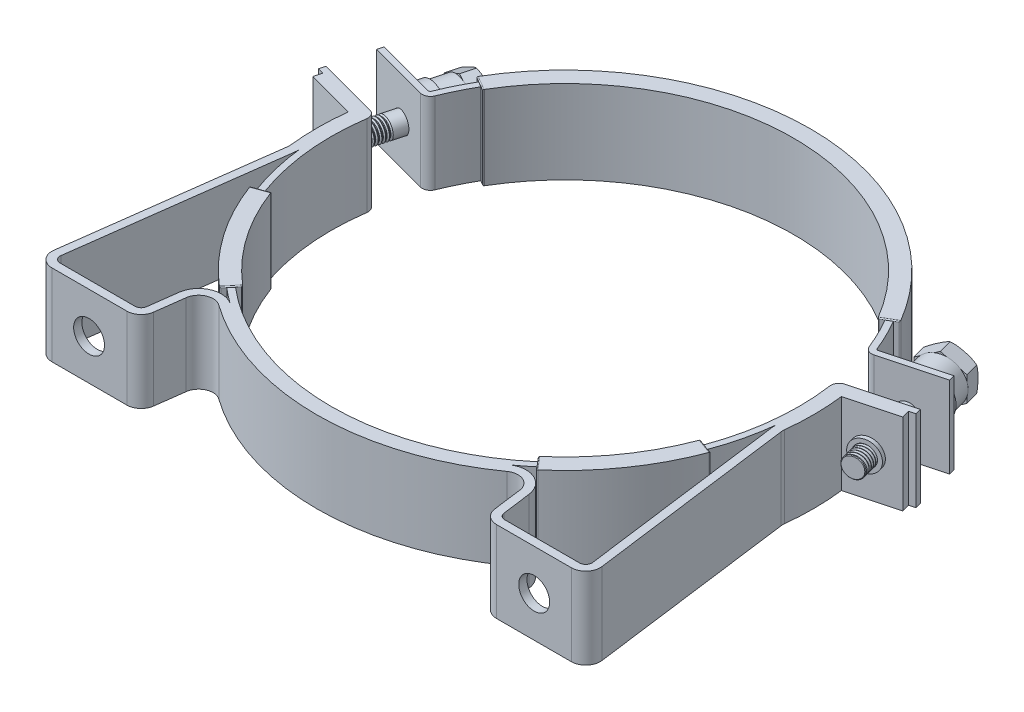
from build123d import *

# Parameters (mm, degrees)
AUFSATZ_LINEAR_AUSTRAGEN1_DEPTH      = 39.5
AUFSATZ_LINEAR_AUSTRAGEN1_2_DEPTH    = 39.5
AUFSATZ_LINEAR_AUSTRAGEN2_DEPTH      = 20.25
AUFSATZ_LINEAR_AUSTRAGEN2_DEPTH_BACK = 20.25
VERRUNDUNG1_START                    = -142
VERRUNDUNG1_DEPTH                    = 8.952459693
VERRUNDUNG1_START_2                  = -0.5
VERRUNDUNG1_2_DEPTH                  = 40.5
VERRUNDUNG2_R                        = 0.5
VERRUNDUNG3_R                        = 0.5
VERRUNDUNG4_R                        = 0.5
VERRUNDUNG5_R                        = 0.5
VERRUNDUNG6_R                        = 0.5
SCHNITT_LINEAR_AUSTRAGEN1_REACH      = 211.137
SKIZZE6_R                            = 5.1
SCHNITT_LINEAR_AUSTRAGEN2_REACH      = 286.937
SKIZZE7_R                            = 7.5
AUFSATZ_LINEAR_START                 = 2
SKIZZE8_R                            = 7.1
SKIZZE8_R_2                          = 5.1
AUFSATZ_LINEAR_AUSTRAGEN3_DEPTH      = 2
SKIZZE9_R                            = 7.1
SKIZZE9_R_2                          = 5.1
AUFSATZ_LINEAR_AUSTRAGEN4_DEPTH      = 2
SKIZZE10_R                           = 5.1
SCHNITT_LINEAR_AUSTRAGEN3_DEPTH      = 209.762581045
SKIZZE11_R                           = 12
SKIZZE11_R_2                         = 5.1
AUFSATZ_LINEAR_AUSTRAGEN5_DEPTH      = 10
SKIZZE12_R                           = 11
SKIZZE12_R_2                         = 5.1
AUFSATZ_LINEAR_AUSTRAGEN6_DEPTH      = 10
AUFSATZ_LINEAR_AUSTRAGEN7_DEPTH      = 8
SKIZZE17_R                           = 5
AUFSATZ_LINEAR_AUSTRAGEN8_DEPTH      = 40
FASE1_SIZE                           = 0.3
SKIZZE18_R                           = 5
AUFSATZ_LINEAR_AUSTRAGEN9_DEPTH      = 40
FASE2_SIZE                           = 0.3
GEWINDE1_PITCH                       = 1.5
GEWINDE2_PITCH                       = 1.5


with BuildPart() as part:
    # Skizze1 → Aufsatz-Linear austragen1 (new body)
    with BuildSketch(Plane(origin=(0, 0, 0), x_dir=(1, 0, 0), z_dir=(0, 1, 0))):
        with BuildLine():
            Line((144.2235429, 72.395909932), (115.275972117, 64.639431727))
            ThreePointArc((115.275972117, 64.639431727), (112.972683108, 62.978903965), (112.351716442, 60.208183281))
            ThreePointArc((112.351716442, 60.208183281), (4.8e-08, -69.395910091), (-112.351716346, 60.208183281))
            ThreePointArc((-112.351716346, 60.208183281), (-112.972683012, 62.978903965), (-115.275972021, 64.639431727))
            Line((-115.275972021, 64.639431727), (-144.223542785, 72.395909927))
            Line((-144.223542785, 72.395909927), (-144.999999917, 69.49813246))
            Line((-144.999999917, 69.49813246), (-142.102222502, 68.721675341))
            Line((-142.102222502, 68.721675341), (-143.137498683, 64.857972036))
            Line((-143.137498683, 64.857972036), (-119.629854786, 58.559117832))
            ThreePointArc((-119.629854786, 58.559117832), (-120.498608358, 44.683203119), (-119.763266415, 30.799579165))
            ThreePointArc((-119.763266415, 30.799579165), (-119.720827887, 29.955782858), (-119.780354587, 29.11301966))
            Line((-119.780354587, 29.11301966), (-132.958143829, -70.982226753))
            ThreePointArc((-132.958143829, -70.982226753), (-131.28090846, -76.511330778), (-126.018029832, -78.895910061))
            Line((-126.018029832, -78.895910061), (-89.707387273, -78.895910061))
            ThreePointArc((-89.707387273, -78.895910061), (-85.091966551, -77.158788715), (-82.767273229, -72.809593391))
            Line((-82.767273229, -72.809593391), (-80.925582719, -58.820564741))
            ThreePointArc((-80.925582719, -58.820564741), (-76.778386451, -53.315555775), (-69.923521345, -54.033319652))
            ThreePointArc((-69.923521345, -54.033319652), (-5.5e-08, -76.395910029), (69.92352124, -54.03331967))
            ThreePointArc((69.92352124, -54.03331967), (76.778386357, -53.315555769), (80.92558264, -58.820564741))
            Line((80.92558264, -58.820564741), (82.76727315, -72.809593391))
            ThreePointArc((82.76727315, -72.809593391), (85.091966472, -77.158788715), (89.707387194, -78.895910061))
            Line((89.707387194, -78.895910061), (126.018029752, -78.895910061))
            ThreePointArc((126.018029752, -78.895910061), (131.280908381, -76.511330777), (132.958143749, -70.982226749))
            Line((132.958143749, -70.982226749), (119.780354507, 29.11301966))
            ThreePointArc((119.780354507, 29.11301966), (119.720827807, 29.955782857), (119.763266335, 30.799579163))
            ThreePointArc((119.763266335, 30.799579163), (120.498608279, 44.683203118), (119.629854707, 58.559117831))
            Line((119.629854707, 58.559117831), (143.137498571, 64.857972025))
            Line((143.137498571, 64.857972025), (142.102222389, 68.721675334))
            Line((142.102222389, 68.721675334), (144.999999989, 69.498132628))
            Line((144.999999989, 69.498132628), (144.2235429, 72.395909932))
        make_face()
        with BuildLine():
            Line((115.814575058, 28.5909149), (128.992364281, -71.504331512))
            ThreePointArc((128.992364281, -71.504331512), (128.273549117, -73.873947541), (126.018029687, -74.895910099))
            Line((126.018029687, -74.895910099), (89.707387107, -74.895910099))
            ThreePointArc((89.707387107, -74.895910099), (87.729349611, -74.151429496), (86.73305246, -72.287488592))
            Line((86.73305246, -72.287488592), (84.891362054, -58.298459981))
            ThreePointArc((84.891362054, -58.298459981), (78.374339367, -49.647731616), (67.602408509, -50.775646305))
            ThreePointArc((67.602408509, -50.775646305), (100.447382842, -14.909241346), (115.787722318, 31.241222664))
            ThreePointArc((115.787722318, 31.241222664), (115.721033153, 29.915257057), (115.814575058, 28.5909149))
        make_face(mode=Mode.SUBTRACT)
        with BuildLine():
            Line((-84.8913622, -58.298459946), (-86.733052605, -72.287488545))
            ThreePointArc((-86.733052605, -72.287488545), (-87.729349763, -74.151429427), (-89.707387248, -74.89591002))
            Line((-89.707387248, -74.89591002), (-126.018029829, -74.89591002))
            ThreePointArc((-126.018029829, -74.89591002), (-128.273549258, -73.873947461), (-128.992364422, -71.504331432))
            Line((-128.992364422, -71.504331432), (-115.814575199, 28.59091498))
            ThreePointArc((-115.814575199, 28.59091498), (-115.721033243, 29.915257139), (-115.787722358, 31.241222754))
            ThreePointArc((-115.787722358, 31.241222754), (-100.447382929, -14.909241248), (-67.60240865, -50.775646226))
            ThreePointArc((-67.60240865, -50.775646226), (-78.374339529, -49.647731545), (-84.8913622, -58.298459946))
        make_face(mode=Mode.SUBTRACT)
    extrude(amount=AUFSATZ_LINEAR_AUSTRAGEN1_DEPTH)



with BuildPart() as body_2:
    # Skizze1 → Aufsatz-Linear austragen1 2 (new body)
    with BuildSketch(Plane(origin=(0, 0, 0), x_dir=(1, 0, 0), z_dir=(0, 1, 0))):
        with BuildLine():
            Line((110.099591321, 83.957948398), (139.047161711, 91.714426507))
            Line((139.047161711, 91.714426507), (138.270704595, 94.612203912))
            Line((138.270704595, 94.612203912), (109.323133796, 86.855725696))
            ThreePointArc((109.323133796, 86.855725696), (108.616891131, 86.927329376), (108.136107822, 87.449587165))
            ThreePointArc((108.136107822, 87.449587165), (-2.29e-07, 160.604089878), (-108.136108295, 87.449587187))
            ThreePointArc((-108.136108295, 87.449587187), (-108.616891604, 86.927329398), (-109.323134269, 86.855725719))
            Line((-109.323134269, 86.855725719), (-138.270705059, 94.612203933))
            Line((-138.270705059, 94.612203933), (-139.047162195, 91.714426455))
            Line((-139.047162195, 91.714426455), (-110.099591405, 83.957948238))
            ThreePointArc((-110.099591405, 83.957948238), (-107.274620727, 84.244362961), (-105.351487478, 86.333394131))
            ThreePointArc((-105.351487478, 86.333394131), (-9.3e-08, 157.604090165), (105.351487396, 86.333394285))
            ThreePointArc((105.351487396, 86.333394285), (107.274620646, 84.244363119), (110.099591321, 83.957948398))
        make_face()
    extrude(amount=AUFSATZ_LINEAR_AUSTRAGEN1_2_DEPTH)


with BuildPart() as part_1:
    add(part.part)

    add(body_2.part)  # Aufsatz-Linear austragen2 merges body 2
    # Skizze5 → Aufsatz-Linear austragen2 (add, two sides: drawn at the far end of the back side and taken through both)
    with BuildSketch(Plane(origin=(0, 19.75, 0), x_dir=(1, 0, 0), z_dir=(0, 1, 0)).offset(-AUFSATZ_LINEAR_AUSTRAGEN2_DEPTH_BACK)):
        with BuildLine():
            Line((-104.133812627, 5.670392928), (-111.651424736, 2.934205889))
            ThreePointArc((-111.651424736, 2.934205889), (-97.479093281, -24.151505937), (-76.874072584, -46.733000266))
            Line((-76.874072584, -46.733000266), (-71.731723043, -40.604586726))
            ThreePointArc((-71.731723043, -40.604586726), (-90.925876926, -19.562894447), (-104.133812627, 5.670392928))
        make_face()
        with BuildLine():
            Line((71.731723023, -40.604586726), (76.874072564, -46.733000266))
            ThreePointArc((76.874072564, -46.733000266), (97.479093261, -24.151505937), (111.651424716, 2.934205889))
            Line((111.651424716, 2.934205889), (104.133812607, 5.670392928))
            ThreePointArc((104.133812607, 5.670392928), (90.925876906, -19.562894447), (71.731723023, -40.604586726))
        make_face()
        with BuildLine():
            Line((95.877844551, 100.036539624), (102.806113346, 104.036577478))
            ThreePointArc((102.806113346, 104.036577478), (-1e-08, 163.104089988), (-102.806113366, 104.036577478))
            Line((-102.806113366, 104.036577478), (-95.877844571, 100.036539624))
            ThreePointArc((-95.877844571, 100.036539624), (-1e-08, 155.104089988), (95.877844551, 100.036539624))
        make_face()
    extrude(amount=AUFSATZ_LINEAR_AUSTRAGEN2_DEPTH + AUFSATZ_LINEAR_AUSTRAGEN2_DEPTH_BACK)

    # Verrundung1: read off the stored shape, not the designer's step
    # Verrundung1 outline → Verrundung1 (cut)
    with BuildSketch(Plane(origin=(0, 0, 0), x_dir=(0.49999999999999767, 0, -0.86602540378444), z_dir=(0.8660254037844399, 0, 0.49999999999999795)).offset(VERRUNDUNG1_START)):
        with BuildLine():
            ThreePointArc((39.195262336, -0.5), (38.841708945, -0.353553391), (38.695262336, 0))
            Line((38.695262336, 0), (38.695262336, -0.5))
            Line((38.695262336, -0.5), (39.195262336, -0.5))
        make_face()
        with BuildLine():
            ThreePointArc((38.695262336, 39.5), (38.841708945, 39.853553391), (39.195262336, 40))
            Line((39.195262336, 40), (38.695262336, 40))
            Line((38.695262336, 40), (38.695262336, 39.5))
        make_face()
    extrude(amount=VERRUNDUNG1_DEPTH, mode=Mode.SUBTRACT)

    # Verrundung1 2 outline → Verrundung1 2 (cut)
    with BuildSketch(Plane(origin=(0, 0, 0), x_dir=(1, 0, 0), z_dir=(0, 1, 0)).offset(VERRUNDUNG1_START_2)):
        with BuildLine():
            ThreePointArc((-102.370356178, 103.784992948), (-102.603860828, 104.090635116), (-102.551243757, 104.471650864))
            ThreePointArc((-102.551243757, 104.471650864), (-102.678908999, 104.254249163), (-102.806113366, 104.036577478))
            Line((-102.806113366, 104.036577478), (-102.370356178, 103.784992948))
        make_face()
        with BuildLine():
            ThreePointArc((-95.627195798, 100.463999727), (-95.930706485, 100.23433482), (-96.307948932, 100.284860492))
            Line((-96.307948932, 100.284860492), (-95.877844571, 100.036539624))
            ThreePointArc((-95.877844571, 100.036539624), (-95.752758718, 100.250409544), (-95.627195798, 100.463999727))
        make_face()
    extrude(amount=VERRUNDUNG1_2_DEPTH, mode=Mode.SUBTRACT)

    # Verrundung2
    # the kernel refuses this fillet: 0.5 mm, written as the material it takes off along each edge
    with BuildSketch(Plane(origin=(95.877844551, 41.241604342, -100.036539624), x_dir=(-0.5058226987035669, 0, -0.8626374658431203), z_dir=(0, -1, 0))) as verrundung2_piece_1:
        with BuildLine():
            CenterArc((0.496642991, 0.499998754), VERRUNDUNG2_R, 180.385980176, 89.486129618)
            Line((-0.003345664, 0.496630467), (0, 0))
            ThreePointArc((0, 0), (0.24776347, 0.000276517), (0.495526939, 0))
        make_face()
    extrude(amount=42.983208684, mode=Mode.SUBTRACT)
    with BuildSketch(Plane(origin=(102.806113346, 41.260573701, -104.036577478), x_dir=(-0.5054635224785541, 0, -0.8628479746998148), z_dir=(0, -1, 0))) as verrundung2_piece_2:
        with BuildLine():
            CenterArc((0.503170175, -0.499998878), VERRUNDUNG2_R, 89.878612425, 90.483514427)
            Line((0.003180161, -0.50315901), (0, 0))
            ThreePointArc((0, 0), (0.25211474, 0.000267067), (0.50422948, 0))
        make_face()
    extrude(amount=43.021147401, mode=Mode.SUBTRACT)
    with BuildSketch(Plane(origin=(94.795312797, -0.5, -99.411539624), x_dir=(-0.49999999999999944, 0, -0.866025403784439), z_dir=(0.866025403784439, 0, -0.49999999999999944))) as verrundung2_piece_3:
        with BuildLine():
            CenterArc((VERRUNDUNG2_R, VERRUNDUNG2_R), VERRUNDUNG2_R, 180, 90)
            Line((0, VERRUNDUNG2_R), (0, 0))
            Line((0, 0), (VERRUNDUNG2_R, 0))
        make_face()
    extrude(amount=10.500075707, mode=Mode.SUBTRACT)
    with BuildSketch(Plane(origin=(94.795312797, 40, -99.411539624), x_dir=(-0.49999999999999944, 0, -0.866025403784439), z_dir=(0.866025403784439, 0, -0.49999999999999944))) as verrundung2_piece_4:
        with BuildLine():
            CenterArc((VERRUNDUNG2_R, -VERRUNDUNG2_R), VERRUNDUNG2_R, 90, 90)
            Line((0, -VERRUNDUNG2_R), (0, 0))
            Line((0, 0), (VERRUNDUNG2_R, 0))
        make_face()
    extrude(amount=10.500075707, mode=Mode.SUBTRACT)

    # Verrundung3
    verrundung3_edges = [part_1.edges().sort_by_distance(p)[0] for p in [
        (-111.651424736, 19.75, -2.934205889),
        (-107.892618682, -0.5, -4.302299408),
        (-104.133812627, 19.75, -5.670392928),
        (-107.892618682, 40, -4.302299408),
    ]]
    fillet(verrundung3_edges, radius=VERRUNDUNG3_R - 0.0001)  # a hair under: the kernel refuses the full size

    # Verrundung4
    verrundung4_edges = [part_1.edges().sort_by_distance(p)[0] for p in [
        (-71.731723043, 19.75, 40.604586726),
        (-74.302897814, -0.5, 43.668793496),
        (-76.874072584, 19.75, 46.733000266),
        (-74.302897814, 40, 43.668793496),
    ]]
    fillet(verrundung4_edges, radius=VERRUNDUNG4_R - 0.0001)  # a hair under: the kernel refuses the full size

    # Verrundung5
    verrundung5_edges = [part_1.edges().sort_by_distance(p)[0] for p in [
        (76.874072564, 19.75, 46.733000266),
        (74.302897794, -0.5, 43.668793496),
        (71.731723023, 19.75, 40.604586726),
        (74.302897794, 40, 43.668793496),
    ]]
    fillet(verrundung5_edges, radius=VERRUNDUNG5_R - 0.0001)  # a hair under: the kernel refuses the full size

    # Verrundung6
    verrundung6_edges = [part_1.edges().sort_by_distance(p)[0] for p in [
        (104.133812607, 19.75, -5.670392928),
        (107.892618662, -0.5, -4.302299408),
        (111.651424716, 19.75, -2.934205889),
        (107.892618662, 40, -4.302299408),
    ]]
    fillet(verrundung6_edges, radius=VERRUNDUNG6_R - 0.0001)  # a hair under: the kernel refuses the full size

    # Skizze6 → Schnitt-Linear austragen1 (cut, up to next)
    with BuildSketch(Plane(origin=(-6.626098717, 0, -24.728937051), x_dir=(0.9659258262495816, 0, -0.25881904524988736), z_dir=(0.25881904524988736, 0, 0.9659258262495816)), mode=Mode.PRIVATE) as schnitt_linear_austragen1_sk1:
        with Locations((141.046685129, 19.400568229)):
            Circle(SKIZZE6_R)
    schnitt_linear_austragen1_tool1 = extrude(schnitt_linear_austragen1_sk1.sketch, amount=-SCHNITT_LINEAR_AUSTRAGEN1_REACH, mode=Mode.PRIVATE) & part_1.part
    schnitt_linear_austragen1 = schnitt_linear_austragen1_tool1.solids().sort_by_distance((129.614537, 19.400568, -61.234505))[0]
    add(schnitt_linear_austragen1, mode=Mode.SUBTRACT)

    # Spiegeln1: Schnitt-Linear austragen1 across plane
    add(schnitt_linear_austragen1.mirror(Plane(origin=(0, 0, 0), x_dir=(0, 0, 1), z_dir=(1, 0, 0))), mode=Mode.SUBTRACT)

    # Skizze7 → Schnitt-Linear austragen2 (cut, up to next)
    with BuildSketch(Plane.XY.offset(78.895910061), mode=Mode.PRIVATE) as schnitt_linear_austragen2_sk1:
        with Locations((108, 19.75)):
            Circle(SKIZZE7_R)
    schnitt_linear_austragen2_tool1 = extrude(schnitt_linear_austragen2_sk1.sketch, amount=-SCHNITT_LINEAR_AUSTRAGEN2_REACH, mode=Mode.PRIVATE) & part_1.part
    # Skizze7 → Schnitt-Linear austragen2 (cut, up to next)
    with BuildSketch(Plane.XY.offset(78.895910061), mode=Mode.PRIVATE) as schnitt_linear_austragen2_sk2:
        with Locations((-108, 19.75)):
            Circle(SKIZZE7_R)
    schnitt_linear_austragen2_tool2 = extrude(schnitt_linear_austragen2_sk2.sketch, amount=-SCHNITT_LINEAR_AUSTRAGEN2_REACH, mode=Mode.PRIVATE) & part_1.part
    add(schnitt_linear_austragen2_tool1.solids().sort_by_distance((108, 19.75, 78.89591))[0], mode=Mode.SUBTRACT)
    add(schnitt_linear_austragen2_tool2.solids().sort_by_distance((-108, 19.75, 78.89591))[0], mode=Mode.SUBTRACT)

    # Skizze8 → Aufsatz-Linear austragen3 (add)
    with BuildSketch(Plane(origin=(-6.626098717, 0, -24.728937051), x_dir=(0.9659258262495816, 0, -0.25881904524988736), z_dir=(0.25881904524988736, 0, 0.9659258262495816)).offset(AUFSATZ_LINEAR_START)):
        with Locations(Location((141.046685129, 19.400568229, 0), (0, 0, 180))):
            Circle(SKIZZE8_R)
        with Locations((141.046685129, 19.400568229)):
            Circle(SKIZZE8_R_2, mode=Mode.SUBTRACT)
    extrude(amount=-AUFSATZ_LINEAR_AUSTRAGEN3_DEPTH)

    # Skizze9 → Aufsatz-Linear austragen4 (add)
    with BuildSketch(Plane(origin=(6.626098711, 0, -24.72893702), x_dir=(0.9659258262269369, 0, 0.2588190453343987), z_dir=(-0.2588190453343987, 0, 0.9659258262269369)).offset(AUFSATZ_LINEAR_START)):
        with Locations(Location((-141.046685131, 19.400568229, 0), (0, 0, 180))):
            Circle(SKIZZE9_R)
        with Locations((-141.046685131, 19.400568229)):
            Circle(SKIZZE9_R_2, mode=Mode.SUBTRACT)
    extrude(amount=-AUFSATZ_LINEAR_AUSTRAGEN4_DEPTH)

    # Skizze10 → Schnitt-Linear austragen3 (cut, through all)
    with BuildSketch(Plane(origin=(-13.614212954, 0, -50.808934448), x_dir=(0.9659258262859906, 0, -0.25881904511400716), z_dir=(0.25881904511400716, 0, 0.9659258262859906))):
        with Locations((141.046685125, 19.400568229)):
            Circle(SKIZZE10_R)
    schnitt_linear_austragen3 = extrude(amount=-SCHNITT_LINEAR_AUSTRAGEN3_DEPTH, mode=Mode.SUBTRACT)

    # Spiegeln2: Schnitt-Linear austragen3 across plane
    add(schnitt_linear_austragen3.mirror(Plane(origin=(0, 0, 0), x_dir=(0, 0, 1), z_dir=(1, 0, 0))), mode=Mode.SUBTRACT)

    # Skizze11 → Aufsatz-Linear austragen5 (add)
    with BuildSketch(Plane(origin=(-14.390670069, 0, -53.706711865), x_dir=(-0.9659258263042477, 0, 0.25881904504587033), z_dir=(-0.25881904504587033, 0, -0.9659258263042477))):
        with Locations(Location((-141.046685121, 19.400568229, 0), (0, 0, 180))):
            Circle(SKIZZE11_R)
        with Locations(Location((-141.046685121, 19.400568229, 0), (0, 0, 180))):
            Circle(SKIZZE11_R_2, mode=Mode.SUBTRACT)
    aufsatz_linear_austragen5 = extrude(amount=AUFSATZ_LINEAR_AUSTRAGEN5_DEPTH)

    # Skizze12 → Aufsatz-Linear austragen6 (add)
    with BuildSketch(Plane(origin=(-16.97886052, 0, -63.365970128), x_dir=(-0.9659258263042477, 0, 0.25881904504587033), z_dir=(-0.25881904504587033, 0, -0.9659258263042477))):
        with Locations((-141.046685121, 19.400568229)):
            Circle(SKIZZE12_R)
        with Locations(Location((-141.046685121, 19.400568229, 0), (0, 0, 180))):
            Circle(SKIZZE12_R_2, mode=Mode.SUBTRACT)
    aufsatz_linear_austragen6 = extrude(amount=AUFSATZ_LINEAR_AUSTRAGEN6_DEPTH)

    # Spiegeln3: Aufsatz-Linear austragen5, Aufsatz-Linear austragen6 across plane
    add(aufsatz_linear_austragen5.mirror(Plane(origin=(0, 0, 0), x_dir=(0, 0, 1), z_dir=(1, 0, 0))))
    add(aufsatz_linear_austragen6.mirror(Plane(origin=(0, 0, 0), x_dir=(0, 0, 1), z_dir=(1, 0, 0))))

    # Skizze13 → Aufsatz-Linear austragen7 (add)
    with BuildSketch(Plane(origin=(-19.56705097, 0, -73.025228391), x_dir=(-0.9659258263042477, 0, 0.25881904504587033), z_dir=(-0.25881904504587033, 0, -0.9659258263042477))):
        Polygon((-141.046685121, 31.524923882), (-151.546685121, 25.462746055), (-151.546685121, 13.338390402), (-141.046685121, 7.276212576), (-130.546685121, 13.338390402), (-130.546685121, 25.462746055), align=None)
    aufsatz_linear_austragen7 = extrude(amount=AUFSATZ_LINEAR_AUSTRAGEN7_DEPTH)

    # Skizze16 → Schnitt-Rotation3 (revolve, cut)
    with BuildSketch(Plane(origin=(25.945713156, -46.524580046, -6.952132885), x_dir=(-0.8756408079341753, -0.47765950157375275, -0.07137629884421755), z_dir=(0.4829629131521228, -0.8660254037844393, -0.12940952252293472)), mode=Mode.PRIVATE) as schnitt_rotation3_sk:
        with BuildLine():
            Line((-112.83112855, 122.421447649), (-113.223544877, 121.153138144))
            ThreePointArc((-113.223544877, 121.153138144), (-111.607430346, 121.585875051), (-109.935471711, 121.525528305))
            Line((-109.935471711, 121.525528305), (-112.83112855, 122.421447649))
        make_face()
        with BuildLine():
            Line((-107.138004808, 120.659989034), (-107.039814872, 120.629608962))
            ThreePointArc((-107.039814872, 120.629608962), (-107.088860492, 120.644958493), (-107.138004808, 120.659989034))
        make_face()
    schnitt_rotation3 = revolve(schnitt_rotation3_sk.sketch.rotate(Axis((114.603032543, 19.400568229, -117.258203352), (-0.2588190450458711, -1.3972034756133337e-15, -0.9659258263042476)), 47.341442803), axis=Axis((114.603032543, 19.400568229, -117.258203352), (-0.2588190450458711, -1.3972034756133337e-15, -0.9659258263042476)), mode=Mode.SUBTRACT)

    # Spiegeln4: Aufsatz-Linear austragen7, Schnitt-Rotation3 across plane
    add(aufsatz_linear_austragen7.mirror(Plane(origin=(0, 0, 0), x_dir=(0, 0, 1), z_dir=(1, 0, 0))))
    add(schnitt_rotation3.mirror(Plane(origin=(0, 0, 0), x_dir=(0, 0, 1), z_dir=(1, 0, 0))), mode=Mode.SUBTRACT)


with BuildPart() as body_2_2:
    # Skizze17 → Aufsatz-Linear austragen8 (new body)
    with BuildSketch(Plane(origin=(-14.390670069, 0, -53.706711865), x_dir=(-0.9659258263042477, 0, 0.25881904504587033), z_dir=(-0.25881904504587033, 0, -0.9659258263042477))):
        with Locations((-141.046685122, 19.400568229)):
            Circle(SKIZZE17_R)
    extrude(amount=-AUFSATZ_LINEAR_AUSTRAGEN8_DEPTH)

    # Fase1
    fase1_edges = [body_2_2.edges().sort_by_distance(p)[0] for p in [
        (137.032356738, 19.400568229, -52.869342388),
    ]]
    chamfer(fase1_edges, length=FASE1_SIZE)

    # Gewinde1: arcs per turn and ends read off the stored shape
    # Gewinde1: the profile of Gewindeprofil1 profile screwed along a right-hand helix through 20 turns, 8 arcs to a turn; built about Z, then put on its axis
    gewinde1_z = Axis((0, 0, 0), (0, 0, 1))
    gewinde1_corners = [(5.0003, 0, -0.000173205), (5.0003, 0, 1.312673201), (4.188101188, 0, 0.843749998), (4.188101188, 0, 0.468749998)]
    with BuildLine(mode=Mode.PRIVATE) as gewinde1_profile:
        Line(gewinde1_corners[0], gewinde1_corners[1])
        Line(gewinde1_corners[1], gewinde1_corners[2])
        Line(gewinde1_corners[2], gewinde1_corners[3])
        Line(gewinde1_corners[3], gewinde1_corners[0])
    gewinde1_cap = Face(gewinde1_profile.wire())
    gewinde1_turn_angles = [0, 22.5, 45, 67.5, 90, 112.5, 135, 157.5, 180, 202.5, 225, 247.5, 270, 292.5, 315, 337.5, 360]
    gewinde1_turn_weights = [1, 0.9238795325112867, 1, 0.9238795325112867, 1, 0.9238795325112867, 1, 0.9238795325112867, 1, 0.9238795325112867, 1, 0.9238795325112867, 1, 0.9238795325112867, 1, 0.9238795325112867, 1]
    gewinde1_turn_rails = [Edge.make_bspline([Vector(p[0], p[1], 0).rotate(gewinde1_z, gewinde1_turn_angles[k]) / gewinde1_turn_weights[k] + Vector(0, 0, p[2] + GEWINDE1_PITCH * gewinde1_turn_angles[k] / 360) for k in range(17)], [0, 0, 0, 1, 1, 2, 2, 3, 3, 4, 4, 5, 5, 6, 6, 7, 7, 8, 8, 8], 2, gewinde1_turn_weights) for p in gewinde1_corners]
    gewinde1_turn_sides = [Face.make_surface_from_curves(gewinde1_turn_rails[p[0]], gewinde1_turn_rails[p[1]]) for p in [(0, 1), (1, 2), (2, 3), (3, 0)]]
    gewinde1 = Plane(origin=(132.125081893, 19.400568229, -51.865024911), x_dir=(-0.965925826, 0, 0.258819045), z_dir=(-0.258819045, 0, -0.965925826)) * Solid(Shell([*[p.moved(Location((0, 0, GEWINDE1_PITCH * i))) for i in range(20) for p in gewinde1_turn_sides], gewinde1_cap, gewinde1_cap.rotate(gewinde1_z, 7200).moved(Location((0, 0, GEWINDE1_PITCH * 7200 / 360)))]))
    add(gewinde1, mode=Mode.SUBTRACT)


with BuildPart() as body_3:
    # Skizze18 → Aufsatz-Linear austragen9 (new body)
    with BuildSketch(Plane(origin=(14.390670043, 0, -53.706711768), x_dir=(-0.9659258263033038, 0, -0.258819045049393), z_dir=(0.258819045049393, 0, -0.9659258263033038))):
        with Locations((141.046685122, 19.400568229)):
            Circle(SKIZZE18_R)
    extrude(amount=-AUFSATZ_LINEAR_AUSTRAGEN9_DEPTH)

    # Fase2
    fase2_edges = [body_3.edges().sort_by_distance(p)[0] for p in [
        (-127.373098501, 19.400568229, -50.281151841),
    ]]
    chamfer(fase2_edges, length=FASE2_SIZE)

    # Gewinde2: arcs per turn and ends read off the stored shape
    # Gewinde2: the profile of Gewindeprofil2 profile screwed along a right-hand helix through 20 turns, 8 arcs to a turn; built about Z, then put on its axis
    gewinde2_z = Axis((0, 0, 0), (0, 0, 1))
    gewinde2_corners = [(5.0003, 0, -0.000173205), (5.0003, 0, 1.312673201), (4.188101187, 0, 0.843749998), (4.188101187, 0, 0.468749998)]
    with BuildLine(mode=Mode.PRIVATE) as gewinde2_profile:
        Line(gewinde2_corners[0], gewinde2_corners[1])
        Line(gewinde2_corners[1], gewinde2_corners[2])
        Line(gewinde2_corners[2], gewinde2_corners[3])
        Line(gewinde2_corners[3], gewinde2_corners[0])
    gewinde2_cap = Face(gewinde2_profile.wire())
    gewinde2_turn_angles = [0, 22.5, 45, 67.5, 90, 112.5, 135, 157.5, 180, 202.5, 225, 247.5, 270, 292.5, 315, 337.5, 360]
    gewinde2_turn_weights = [1, 0.9238795325112867, 1, 0.9238795325112867, 1, 0.9238795325112867, 1, 0.9238795325112867, 1, 0.9238795325112867, 1, 0.9238795325112867, 1, 0.9238795325112867, 1, 0.9238795325112867, 1]
    gewinde2_turn_rails = [Edge.make_bspline([Vector(p[0], p[1], 0).rotate(gewinde2_z, gewinde2_turn_angles[k]) / gewinde2_turn_weights[k] + Vector(0, 0, p[2] + GEWINDE2_PITCH * gewinde2_turn_angles[k] / 360) for k in range(17)], [0, 0, 0, 1, 1, 2, 2, 3, 3, 4, 4, 5, 5, 6, 6, 7, 7, 8, 8, 8], 2, gewinde2_turn_weights) for p in gewinde2_corners]
    gewinde2_turn_sides = [Face.make_surface_from_curves(gewinde2_turn_rails[p[0]], gewinde2_turn_rails[p[1]]) for p in [(0, 1), (1, 2), (2, 3), (3, 0)]]
    gewinde2 = Plane(origin=(-132.125081919, 19.400568229, -51.865024814), x_dir=(-0.965925826, 0, -0.258819045), z_dir=(0.258819045, 0, -0.965925826)) * Solid(Shell([*[p.moved(Location((0, 0, GEWINDE2_PITCH * i))) for i in range(20) for p in gewinde2_turn_sides], gewinde2_cap, gewinde2_cap.rotate(gewinde2_z, 7200).moved(Location((0, 0, GEWINDE2_PITCH * 7200 / 360)))]))
    add(gewinde2, mode=Mode.SUBTRACT)


solid = Compound([part_1.part, body_2_2.part, body_3.part])
